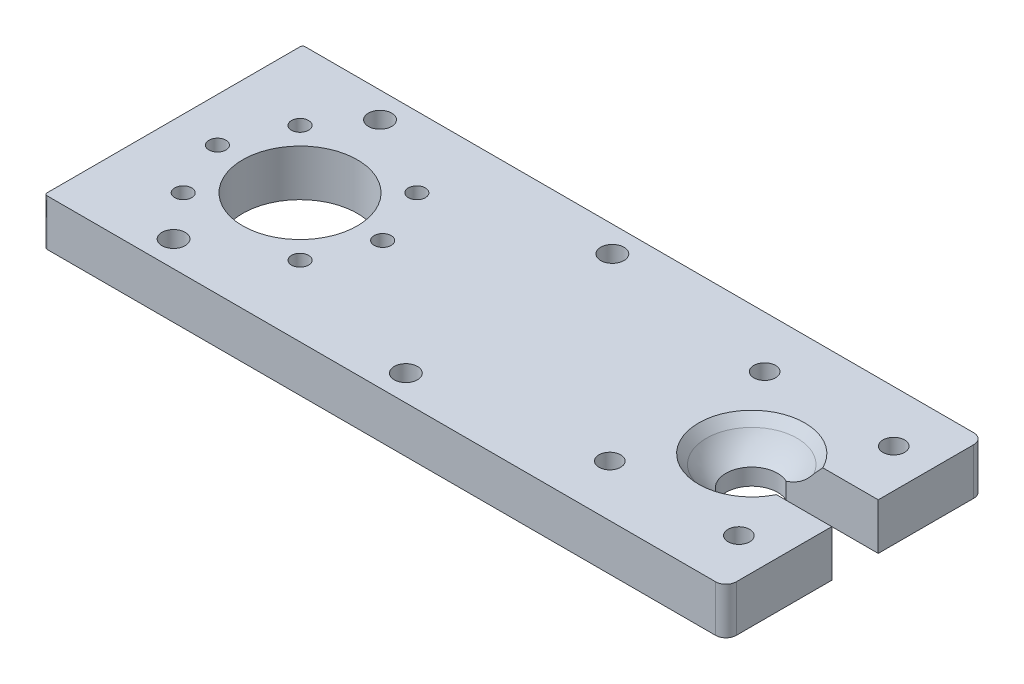
from build123d import *

# Parameters (mm, degrees)
SKETCH1_W                                            = 132
SKETCH1_H                                            = 50
BOSS_EXTRUDE1_DEPTH                                  = 9
M4_TAPPED_HOLE1_D                                    = 3.3
M4_TAPPED_HOLE1_DEPTH                                = 14.008579979
M4_TAPPED_HOLE1_TIP                                  = 0.991420021
FILLET1_R                                            = 0.5
SKETCH5_R                                            = 11.1
CUT_EXTRUDE1_DEPTH                                   = 72.147733625
M5_TAPPED_HOLE1_D                                    = 4.2
CSK_FOR_M4_HEX_SOCKET_COUNTERSUNK_CAP_SC_D           = 4.5
CSK_FOR_M4_HEX_SOCKET_COUNTERSUNK_CAP_SC_CSINK_D     = 8.96
CSK_FOR_M4_HEX_SOCKET_COUNTERSUNK_CAP_SC_CSINK_ANGLE = 90
M4_TAPPED_HOLE2_D                                    = 3.3
CIRPATTERN1_COUNT                                    = 8
CUT_EXTRUDE2_DEPTH                                   = 10
CHAMFER1_SIZE                                        = 0.5
FILLET2_R                                            = 2


with BuildPart() as part:
    # Sketch1 → Boss-Extrude1 (new body)
    with BuildSketch(Plane(origin=(0, 0, 0), x_dir=(1, 0, 0), z_dir=(0, 1, 0))):
        Rectangle(SKETCH1_W, SKETCH1_H)
    extrude(amount=BOSS_EXTRUDE1_DEPTH)

    # M4 Tapped Hole1
    with Locations(Plane.ZY.offset(66)):
        with Locations((-20, 4.5), (20, 4.5)):
            Hole(M4_TAPPED_HOLE1_D / 2, depth=M4_TAPPED_HOLE1_DEPTH)
            with Locations((0, 0, -(M4_TAPPED_HOLE1_DEPTH + M4_TAPPED_HOLE1_TIP / 2))):  # 118° drill point
                Cone(0, M4_TAPPED_HOLE1_D / 2, M4_TAPPED_HOLE1_TIP, mode=Mode.SUBTRACT)

    # Fillet1
    fillet1_edges = [part.edges().sort_by_distance(p)[0] for p in [
        (-66, 4.5, 25),
        (-66, 4.5, -25),
    ]]
    fillet(fillet1_edges, radius=FILLET1_R)

    # Sketch5 → Cut-Extrude1 (cut, through all)
    with BuildSketch(Plane(origin=(0, 9, 0), x_dir=(1, 0, 0), z_dir=(0, 1, 0))):
        with Locations(Location((-41.5, 0, 0), (0, 0, 270))):
            Circle(SKETCH5_R)
    extrude(amount=-CUT_EXTRUDE1_DEPTH, mode=Mode.SUBTRACT)

    # M5 Tapped Hole1 (through all)
    with Locations(Plane(origin=(0, 9, 0), x_dir=(1, 0, 0), z_dir=(0, 1, 0))):
        with Locations((33.5, 15), (33.5, -15), (58.5, -15), (58.5, 15)):
            Hole(M5_TAPPED_HOLE1_D / 2)

    # CSK for M4 Hex Socket Countersunk Cap Screw1 (through all)
    with Locations(Plane(origin=(0, 0, 0), x_dir=(-1, 0, 0), z_dir=(0, -1, 0))):
        with Locations((1, -20), (46, -20), (46, 20), (1, 20)):
            CounterSinkHole(CSK_FOR_M4_HEX_SOCKET_COUNTERSUNK_CAP_SC_D / 2, CSK_FOR_M4_HEX_SOCKET_COUNTERSUNK_CAP_SC_CSINK_D / 2, counter_sink_angle=CSK_FOR_M4_HEX_SOCKET_COUNTERSUNK_CAP_SC_CSINK_ANGLE)

    # M4 Tapped Hole2 (through all)
    with Locations(Plane(origin=(0, 9, 0), x_dir=(1, 0, 0), z_dir=(0, 1, 0))):
        with Locations((-57.5, 0)):
            m4_tapped_hole2 = Hole(M4_TAPPED_HOLE2_D / 2)

    # CirPattern1: M4 Tapped Hole2 ×8 about axis, 2 skipped
    cirpattern1_axis = Axis((-41.5, 0, 0), (0, -1, 0))
    add([m4_tapped_hole2.rotate(cirpattern1_axis, i * 360 / CIRPATTERN1_COUNT) for i in range(1, CIRPATTERN1_COUNT) if i not in (2, 6)], mode=Mode.SUBTRACT)

    # Sketch17 → Cut-Extrude2 (cut)
    with BuildSketch(Plane(origin=(0, 9, 0), x_dir=(1, 0, 0), z_dir=(0, 1, 0))):
        with BuildLine():
            Line((66, -4.5), (66, 4.5))
            Line((66, 4.5), (48.179449472, 4.5))
            ThreePointArc((48.179449472, 4.5), (41, 0), (48.179449472, -4.5))
            Line((48.179449472, -4.5), (66, -4.5))
        make_face()
    extrude(amount=-CUT_EXTRUDE2_DEPTH, mode=Mode.SUBTRACT)

    # Sketch18 → Cut-Revolve1 (revolve, cut)
    with BuildSketch(Plane.XY):
        with BuildLine():
            Line((46, 9), (46, 1.00225345))
            ThreePointArc((46, 1.00225345), (51.841595957, 3.843776079), (55.792779203, 9))
            Line((55.792779203, 9), (46, 9))
        make_face()
    revolve(axis=Axis((46, 9, 0), (0, -1, 0)), mode=Mode.SUBTRACT)

    # Chamfer1
    # the kernel refuses this chamfer: 1.5, 0.5 mm, written as the material it takes off along each edge
    with BuildSketch(Plane(origin=(46, 9, 0), x_dir=(0.9999950652018582, 0, 0.003141587485879922), z_dir=(0.003141587485879922, 0, -0.9999950652018582))) as chamfer1_piece_1:
        with BuildLine():
            Line((9.792779203 + CHAMFER1_SIZE, 0), (8.806159122, 1.826299898))
            ThreePointArc((8.806159122, 1.826299898), (9.31899594, 0.957300628), (9.792779203, 0))
            Line((9.792779203, 0), (9.792779203 + CHAMFER1_SIZE, 0))
        make_face()
    revolve(axis=Axis((46, 9, 0), (0, -1, 0)), revolution_arc=359.64, mode=Mode.SUBTRACT)

    # Fillet2
    fillet2_edges = [part.edges().sort_by_distance(p)[0] for p in [
        (66, 4.5, 25),
        (66, 4.5, -25),
    ]]
    fillet(fillet2_edges, radius=FILLET2_R)


solid = part.part
